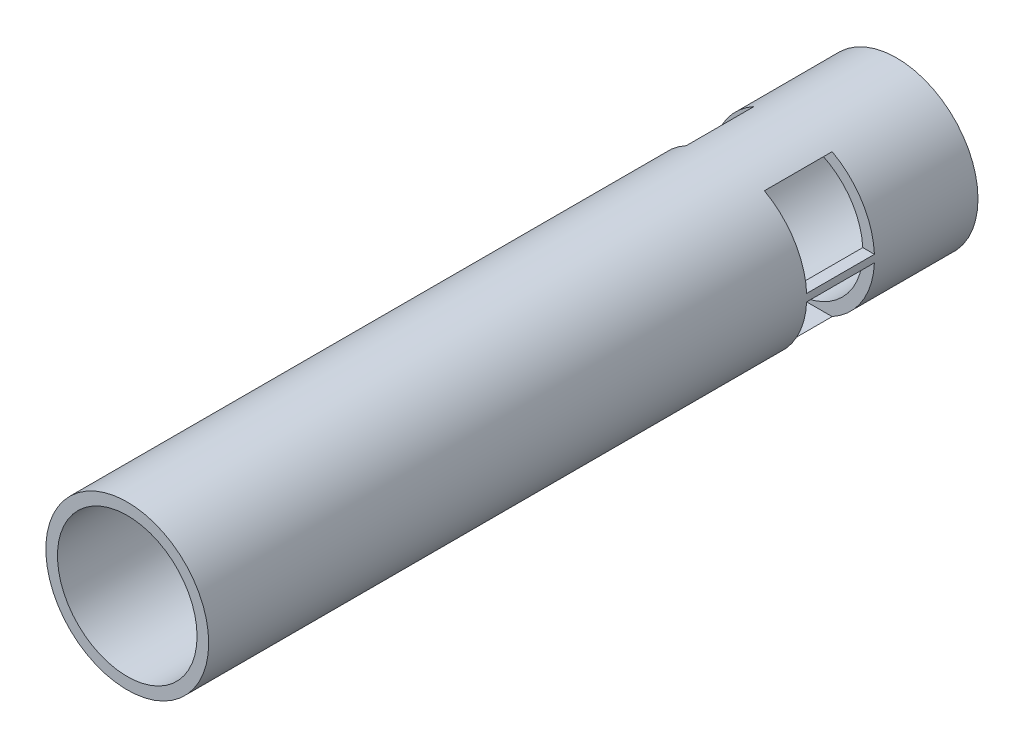
from build123d import *

# Parameters (mm, degrees)
SKETCH1_R               = 44.45
SKETCH1_R_2             = 38.1
BOSS_EXTRUDE1_DEPTH     = 420
CUT_EXTRUDE1_DEPTH      = 425.678237022
CUT_EXTRUDE1_DEPTH_BACK = 63
SKETCH3_W               = 37
SKETCH3_H               = 37


with BuildPart() as part:
    # Sketch1 → Boss-Extrude1 (new body)
    with BuildSketch(Plane.XY):
        Circle(SKETCH1_R)
        Circle(SKETCH1_R_2, mode=Mode.SUBTRACT)
    extrude(amount=BOSS_EXTRUDE1_DEPTH)

    # Sketch3 → Cut-Extrude1 (cut, two sides: drawn at the far end of the back side and taken through both)
    with BuildSketch(Plane(origin=(0, 0, 0), x_dir=(0, 0, -1), z_dir=(1, 0, 0)).offset(-CUT_EXTRUDE1_DEPTH_BACK)):
        with Locations((-75, -20.5)):
            Rectangle(SKETCH3_W, SKETCH3_H)
        with Locations((-75, 20.5)):
            Rectangle(SKETCH3_W, SKETCH3_H)
    extrude(amount=CUT_EXTRUDE1_DEPTH + CUT_EXTRUDE1_DEPTH_BACK, mode=Mode.SUBTRACT)


solid = part.part
